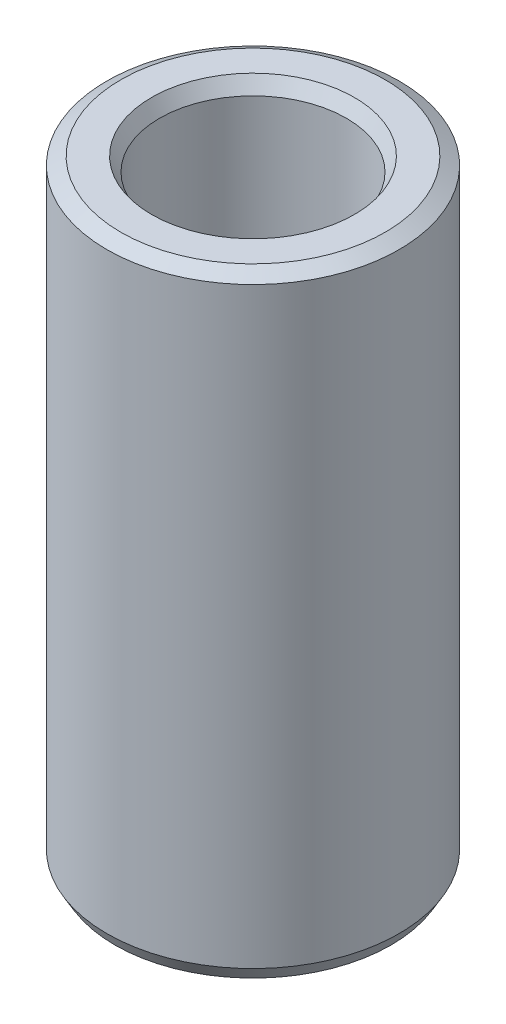
from build123d import *
from OCP.BRepFilletAPI import BRepFilletAPI_MakeChamfer

# Parameters (mm, degrees)
SKETCH1_R           = 22.5
BOSS_EXTRUDE1_DEPTH = 94.603841313
SKETCH2_R           = 14.378555865
CUT_EXTRUDE1_DEPTH  = 100.811756778
CHAMFER1_SIZE       = 1.240395524
CHAMFER1_SIZE2      = 2.14842807


with BuildPart() as part:
    # Sketch1 → Boss-Extrude1 (new body)
    with BuildSketch(Plane(origin=(0, 0, 0), x_dir=(1, 0, 0), z_dir=(0, 1, 0))):
        Circle(SKETCH1_R)
    extrude(amount=BOSS_EXTRUDE1_DEPTH)

    # Sketch2 → Cut-Extrude1 (cut, through all)
    with BuildSketch(Plane(origin=(0, 0, 0), x_dir=(1, 0, 0), z_dir=(0, 1, 0))):
        Circle(SKETCH2_R)
    extrude(amount=CUT_EXTRUDE1_DEPTH, mode=Mode.SUBTRACT)

    # Chamfer1: one chamfer whose edges measure the first distance from different faces: ONE call of the kernel's chamfer builder (chamfer() names one face for all edges)
    chamfer1_edges_1 = [part.edges().sort_by_distance(p)[0] for p in [
        (-14.378555865, 94.603841313, 0),
    ]]
    chamfer1_side_1 = [part.faces().sort_by_distance(p)[0] for p in [
        (-21.863603897, 94.603841313, 0),
    ]]
    chamfer1_edges_2 = [part.edges().sort_by_distance(p)[0] for p in [
        (-14.378555865, 0, 0),
    ]]
    chamfer1_side_2 = [part.faces().sort_by_distance(p)[0] for p in [
        (-14.378555865, 47.301920657, 0),
    ]]
    chamfer1_edges_3 = [part.edges().sort_by_distance(p)[0] for p in [
        (-22.5, 0, 0),
    ]]
    chamfer1_side_3 = [part.faces().sort_by_distance(p)[0] for p in [
        (-21.863603897, 0, 0),
    ]]
    chamfer1_edges_4 = [part.edges().sort_by_distance(p)[0] for p in [
        (-22.5, 94.603841313, 0),
    ]]
    chamfer1_side_4 = [part.faces().sort_by_distance(p)[0] for p in [
        (-22.5, 47.301920657, 0),
    ]]
    chamfer1 = BRepFilletAPI_MakeChamfer(part.part.solid().wrapped)
    for e in chamfer1_edges_1:
        chamfer1.Add(CHAMFER1_SIZE, CHAMFER1_SIZE2, e.wrapped, chamfer1_side_1[0].wrapped)  # the first distance lies on this face
    for e in chamfer1_edges_2:
        chamfer1.Add(CHAMFER1_SIZE, CHAMFER1_SIZE2, e.wrapped, chamfer1_side_2[0].wrapped)  # the first distance lies on this face
    for e in chamfer1_edges_3:
        chamfer1.Add(CHAMFER1_SIZE, CHAMFER1_SIZE2, e.wrapped, chamfer1_side_3[0].wrapped)  # the first distance lies on this face
    for e in chamfer1_edges_4:
        chamfer1.Add(CHAMFER1_SIZE, CHAMFER1_SIZE2, e.wrapped, chamfer1_side_4[0].wrapped)  # the first distance lies on this face
    add(Compound.cast(chamfer1.Shape()), mode=Mode.REPLACE)


solid = part.part
